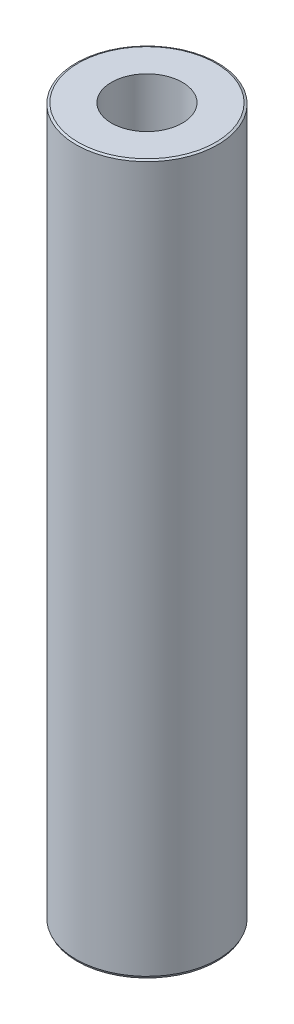
from build123d import *
from OCP.BRepFilletAPI import BRepFilletAPI_MakeChamfer

# Parameters (mm, degrees)
SKETCH1_R           = 60
BOSS_EXTRUDE1_DEPTH = 600
SKETCH2_R           = 29.990113425
CUT_EXTRUDE1_DEPTH  = 606.970296302
CHAMFER1_SIZE       = 0.850810991
CHAMFER1_SIZE2      = 1.83664152


with BuildPart() as part:
    # Sketch1 → Boss-Extrude1 (new body)
    with BuildSketch(Plane(origin=(0, 0, 0), x_dir=(1, 0, 0), z_dir=(0, 1, 0))):
        Circle(SKETCH1_R)
    extrude(amount=BOSS_EXTRUDE1_DEPTH)

    # Sketch2 → Cut-Extrude1 (cut, through all)
    with BuildSketch(Plane(origin=(0, 0, 0), x_dir=(1, 0, 0), z_dir=(0, 1, 0))):
        Circle(SKETCH2_R)
    extrude(amount=CUT_EXTRUDE1_DEPTH, mode=Mode.SUBTRACT)

    # Chamfer1: one chamfer whose edges measure the first distance from different faces: ONE call of the kernel's chamfer builder (chamfer() names one face for all edges)
    chamfer1_edges_1 = [part.edges().sort_by_distance(p)[0] for p in [
        (-60, 600, 0),
    ]]
    chamfer1_side_1 = [part.faces().sort_by_distance(p)[0] for p in [
        (-60, 300, 0),
    ]]
    chamfer1_edges_2 = [part.edges().sort_by_distance(p)[0] for p in [
        (-60, 0, 0),
    ]]
    chamfer1_side_2 = [part.faces().sort_by_distance(p)[0] for p in [
        (-58.302943725, 0, 0),
    ]]
    chamfer1 = BRepFilletAPI_MakeChamfer(part.part.solid().wrapped)
    for e in chamfer1_edges_1:
        chamfer1.Add(CHAMFER1_SIZE, CHAMFER1_SIZE2, e.wrapped, chamfer1_side_1[0].wrapped)  # the first distance lies on this face
    for e in chamfer1_edges_2:
        chamfer1.Add(CHAMFER1_SIZE, CHAMFER1_SIZE2, e.wrapped, chamfer1_side_2[0].wrapped)  # the first distance lies on this face
    add(Compound.cast(chamfer1.Shape()), mode=Mode.REPLACE)


solid = part.part
